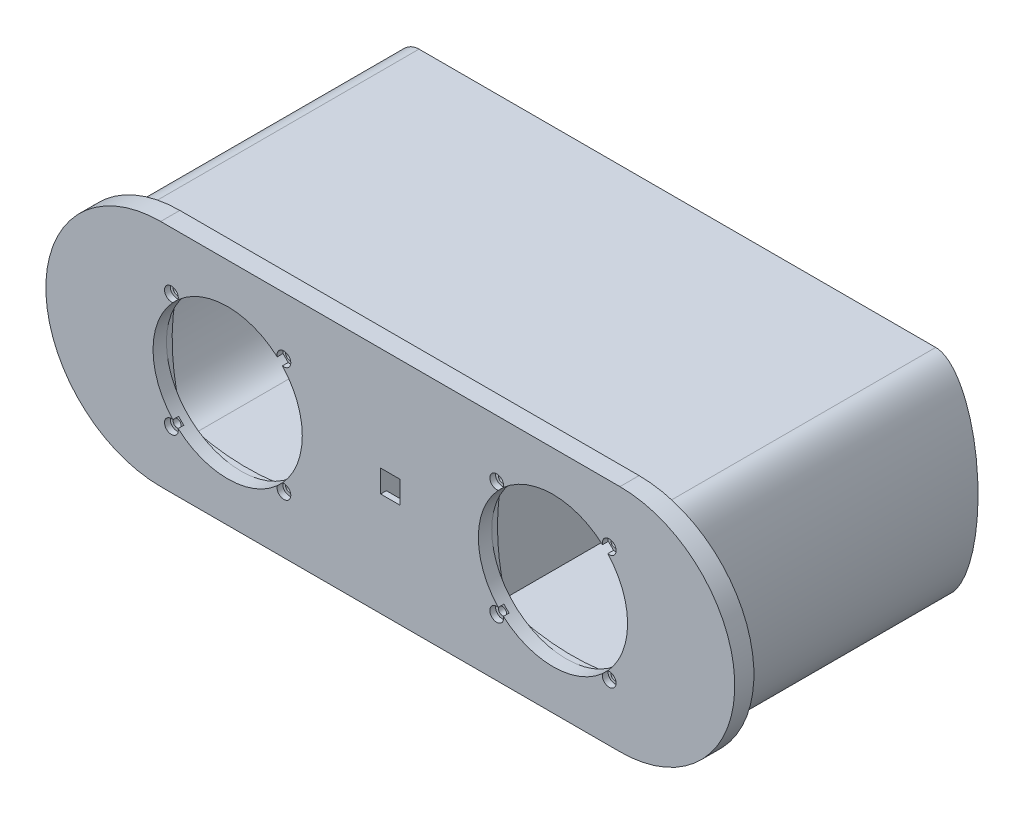
from build123d import *

# Parameters (mm, degrees)
BOSS_EXTRU_1_DEPTH                         = 7
BOSS_EXTRU_1_DEPTH_BACK                    = 3
ESQUISSE2_R                                = 39
ESQUISSE2_R_2                              = 2.1
ENL_V_START                                = -3
ESQUISSE2_5_R                              = 2.1
ENL_V_MAT_EXTRU_1_DEPTH                    = 3
ESQUISSE5_R                                = 3.6
ENL_V_MAT_EXTRU_2_DEPTH                    = 3
ESQUISSE6_W                                = 50
ESQUISSE6_H                                = 105
BOSS_EXTRU_2_DEPTH                         = 140
BOSS_EXTRU_3_DEPTH                         = 14
ESQUISSE8_R                                = 4.05
ENL_V_MAT_EXTRU_3_DEPTH                    = 1.22
SYM_TRIE1_AT_THE_SECOND_PLANE_COPY_1_DEPTH = 14
SYM_TRIE1_AT_THE_SECOND_PLANE_COPY_2_SKE_R = 4.05
SYM_TRIE1_AT_THE_SECOND_PLANE_COPY_2_DEPTH = 1.22
CONG_1_R                                   = 10
ESQUISSE9_R                                = 4.05
ENL_V_MAT_EXTRU_4_DEPTH                    = 1.22
ENL_V_MAT_EXTRU_5_REACH                    = 261.447
ESQUISSE10_R                               = 10
ENL_V_MAT_EXTRU_6_REACH                    = 312.363
ESQUISSE11_W                               = 9.7
ESQUISSE11_H                               = 11.35
D_PLACER_START                             = -90.05
D_PLACER_LA_FACE1_OUTLINE_W                = 11.75
D_PLACER_LA_FACE1_OUTLINE_H                = 10
D_PLACER_LA_FACE1_DEPTH                    = 10.1
ESQUISSE12_W                               = 10.1
ESQUISSE12_H                               = 20
ENL_V_MAT_EXTRU_7_DEPTH                    = 7


# Read off the part's stored shape, not the designer's step: Déplacer la face1
with BuildPart() as part:
    # Esquisse2 → Boss.-Extru.1 (new, two sides: drawn at the far end of the back side and taken through both)
    with BuildSketch(Plane.XY.offset(-BOSS_EXTRU_1_DEPTH_BACK)):
        with BuildLine():
            Line((-205, 60), (35, 60))
            ThreePointArc((35, 60), (95, 0), (35, -60))
            Line((35, -60), (-205, -60))
            ThreePointArc((-205, -60), (-265, 0), (-205, 60))
        make_face()
        Circle(ESQUISSE2_R, mode=Mode.SUBTRACT)
        with Locations((-170, 0)):
            Circle(ESQUISSE2_R, mode=Mode.SUBTRACT)
        with Locations((-140.606123087, 30)):
            Circle(ESQUISSE2_R_2, mode=Mode.SUBTRACT)
        with Locations((-199.393876913, 30)):
            Circle(ESQUISSE2_R_2, mode=Mode.SUBTRACT)
        with Locations((-199.393876913, -30)):
            Circle(ESQUISSE2_R_2, mode=Mode.SUBTRACT)
        with Locations((-140.606123087, -30)):
            Circle(ESQUISSE2_R_2, mode=Mode.SUBTRACT)
        with Locations((29.393876913, -30)):
            Circle(ESQUISSE2_R_2, mode=Mode.SUBTRACT)
        with Locations((-29.393876913, -30)):
            Circle(ESQUISSE2_R_2, mode=Mode.SUBTRACT)
        with Locations((-29.393876913, 30)):
            Circle(ESQUISSE2_R_2, mode=Mode.SUBTRACT)
        with Locations((29.393876913, 30)):
            Circle(ESQUISSE2_R_2, mode=Mode.SUBTRACT)
    extrude(amount=BOSS_EXTRU_1_DEPTH + BOSS_EXTRU_1_DEPTH_BACK)

    # Esquisse2<5> → Enlèv. mat.-Extru.1 (cut)
    # profile 1 of 10: a face of its own
    with BuildSketch(Plane.XY.offset(ENL_V_START)):
        with BuildLine():
            ThreePointArc((-170.000000312, -39), (-142.422835644, -27.577164577), (-131, 0))
            ThreePointArc((-131, 0), (-142.422835466, 27.577164398), (-169.999999807, 39))
            ThreePointArc((-169.999999807, 39), (-197.577164398, 27.577164534), (-209, 0))
            ThreePointArc((-209, 0), (-197.577164577, -27.577164356), (-170.000000312, -39))
        make_face()
    # profile 2 of 10: a face of its own
    with BuildSketch(Plane.XY.offset(ENL_V_START)):
        with BuildLine():
            ThreePointArc((-169.999999807, 39), (-142.422835466, 27.577164398), (-131, 0))
            add(Edge.make_bspline(
                [(-131, 0), (-131, 18.042697598), (-136.4238654, 33.5761346)],
                knots=[4.71238898, 4.71238898, 4.71238898, 5.246097172, 5.246097172, 5.246097172], degree=2, weights=[0.930463264, 0.930463264, 1]))
            add(Edge.make_bspline(
                [(-136.4238654, 33.5761346), (-151.957302313, 38.999999969), (-169.999999807, 39)],
                knots=[1.037088135, 1.037088135, 1.037088135, 1.570796324, 1.570796324, 1.570796324], degree=2, weights=[1, 0.930463264, 0.930463264]))
        make_face()
        with Locations((-140.606123087, 30)):
            Circle(ESQUISSE2_5_R, mode=Mode.SUBTRACT)
    # profile 3 of 10: a face of its own
    with BuildSketch(Plane.XY.offset(ENL_V_START)):
        with BuildLine():
            ThreePointArc((-209, 0), (-197.577164398, 27.577164534), (-169.999999807, 39))
            add(Edge.make_bspline(
                [(-169.999999807, 39), (-188.042697509, 39.000000031), (-203.5761346, 33.5761346)],
                knots=[1.570796324, 1.570796324, 1.570796324, 2.104504518, 2.104504518, 2.104504518], degree=2, weights=[0.930463264, 0.930463264, 1]))
            add(Edge.make_bspline(
                [(-203.5761346, 33.5761346), (-209, 18.042697598), (-209, 0)],
                knots=[4.178680789, 4.178680789, 4.178680789, 4.71238898, 4.71238898, 4.71238898], degree=2, weights=[1, 0.930463264, 0.930463264]))
        make_face()
        with Locations((-199.393876913, 30)):
            Circle(ESQUISSE2_5_R, mode=Mode.SUBTRACT)
    # profile 4 of 10: a face of its own
    with BuildSketch(Plane.XY.offset(ENL_V_START)):
        with BuildLine():
            add(Edge.make_bspline(
                [(-203.5761346, -33.5761346), (-188.042697742, -38.99999995), (-170.000000312, -39)],
                knots=[1.037088135, 1.037088135, 1.037088135, 1.570796322, 1.570796322, 1.570796322], degree=2, weights=[1, 0.930463265, 0.930463264]))
            ThreePointArc((-170.000000312, -39), (-197.577164577, -27.577164356), (-209, 0))
            add(Edge.make_bspline(
                [(-209, 0), (-209, -18.042697598), (-203.5761346, -33.5761346)],
                knots=[4.71238898, 4.71238898, 4.71238898, 5.246097172, 5.246097172, 5.246097172], degree=2, weights=[0.930463264, 0.930463264, 1]))
        make_face()
        with Locations((-199.393876913, -30)):
            Circle(ESQUISSE2_5_R, mode=Mode.SUBTRACT)
    # profile 5 of 10: a face of its own
    with BuildSketch(Plane.XY.offset(ENL_V_START)):
        with BuildLine():
            add(Edge.make_bspline(
                [(-136.4238654, -33.5761346), (-131, -18.042697598), (-131, 0)],
                knots=[4.178680789, 4.178680789, 4.178680789, 4.71238898, 4.71238898, 4.71238898], degree=2, weights=[1, 0.930463264, 0.930463264]))
            ThreePointArc((-131, 0), (-142.422835644, -27.577164577), (-170.000000312, -39))
            add(Edge.make_bspline(
                [(-170.000000312, -39), (-151.957302546, -39.00000005), (-136.4238654, -33.5761346)],
                knots=[1.570796322, 1.570796322, 1.570796322, 2.104504518, 2.104504518, 2.104504518], degree=2, weights=[0.930463264, 0.930463264, 1]))
        make_face()
        with Locations((-140.606123087, -30)):
            Circle(ESQUISSE2_5_R, mode=Mode.SUBTRACT)
    # profile 6 of 10: a face of its own
    with BuildSketch(Plane.XY.offset(ENL_V_START)):
        with BuildLine():
            ThreePointArc((-1.99e-07, -39), (27.577164396, -27.577164537), (39, 0))
            ThreePointArc((39, 0), (27.577164371, 27.577164562), (-2.7e-07, 39))
            ThreePointArc((-2.7e-07, 39), (-27.577164634, 27.577164299), (-39, -2.03e-07))
            ThreePointArc((-39, -2.03e-07), (-27.577164465, -27.577164468), (-1.99e-07, -39))
        make_face()
    # profile 7 of 10: a face of its own
    with BuildSketch(Plane.XY.offset(ENL_V_START)):
        with BuildLine():
            ThreePointArc((-39, -2.03e-07), (-27.577164634, 27.577164299), (-2.7e-07, 39))
            add(Edge.make_bspline(
                [(-2.7e-07, 39), (-18.042697723, 38.999999956), (-33.5761346, 33.5761346)],
                knots=[4.712388984, 4.712388984, 4.712388984, 5.246097172, 5.246097172, 5.246097172], degree=2, weights=[0.930463264, 0.930463265, 1]))
            add(Edge.make_bspline(
                [(-33.5761346, 33.5761346), (-39.000000033, 18.042697504), (-39, -2.03e-07)],
                knots=[1.037088135, 1.037088135, 1.037088135, 1.57079633, 1.57079633, 1.57079633], degree=2, weights=[1, 0.930463264, 0.930463264]))
        make_face()
        with Locations((-29.393876913, 30)):
            Circle(ESQUISSE2_5_R, mode=Mode.SUBTRACT)
    # profile 8 of 10: a face of its own
    with BuildSketch(Plane.XY.offset(ENL_V_START)):
        with BuildLine():
            ThreePointArc((-2.7e-07, 39), (27.577164371, 27.577164562), (39, 0))
            add(Edge.make_bspline(
                [(39, 0), (39, 18.042697598), (33.5761346, 33.5761346)],
                knots=[4.71238898, 4.71238898, 4.71238898, 5.246097172, 5.246097172, 5.246097172], degree=2, weights=[0.930463264, 0.930463264, 1]))
            add(Edge.make_bspline(
                [(33.5761346, 33.5761346), (18.042697473, 39.000000044), (-2.7e-07, 39)],
                knots=[4.178680789, 4.178680789, 4.178680789, 4.712388984, 4.712388984, 4.712388984], degree=2, weights=[1, 0.930463264, 0.930463264]))
        make_face()
        with Locations((29.393876913, 30)):
            Circle(ESQUISSE2_5_R, mode=Mode.SUBTRACT)
    # profile 9 of 10: a face of its own
    with BuildSketch(Plane.XY.offset(ENL_V_START)):
        with BuildLine():
            add(Edge.make_bspline(
                [(33.5761346, -33.5761346), (39, -18.042697598), (39, 0)],
                knots=[4.178680789, 4.178680789, 4.178680789, 4.71238898, 4.71238898, 4.71238898], degree=2, weights=[1, 0.930463264, 0.930463264]))
            ThreePointArc((39, 0), (27.577164396, -27.577164537), (-1.99e-07, -39))
            add(Edge.make_bspline(
                [(-1.99e-07, -39), (18.042697506, -39.000000032), (33.5761346, -33.5761346)],
                knots=[1.570796324, 1.570796324, 1.570796324, 2.104504518, 2.104504518, 2.104504518], degree=2, weights=[0.930463264, 0.930463264, 1]))
        make_face()
        with Locations((29.393876913, -30)):
            Circle(ESQUISSE2_5_R, mode=Mode.SUBTRACT)
    # profile 10 of 10: a face of its own
    with BuildSketch(Plane.XY.offset(ENL_V_START)):
        with BuildLine():
            add(Edge.make_bspline(
                [(-33.5761346, -33.5761346), (-18.04269769, -38.999999968), (-1.99e-07, -39)],
                knots=[1.037088135, 1.037088135, 1.037088135, 1.570796324, 1.570796324, 1.570796324], degree=2, weights=[1, 0.930463264, 0.930463264]))
            ThreePointArc((-1.99e-07, -39), (-27.577164465, -27.577164468), (-39, -2.03e-07))
            add(Edge.make_bspline(
                [(-39, -2.03e-07), (-38.999999967, -18.042697692), (-33.5761346, -33.5761346)],
                knots=[1.57079633, 1.57079633, 1.57079633, 2.104504518, 2.104504518, 2.104504518], degree=2, weights=[0.930463264, 0.930463264, 1]))
        make_face()
        with Locations((-29.393876913, -30)):
            Circle(ESQUISSE2_5_R, mode=Mode.SUBTRACT)
    extrude(amount=ENL_V_MAT_EXTRU_1_DEPTH, mode=Mode.SUBTRACT)

    # Esquisse5 → Enlèv. mat.-Extru.2 (cut)
    with BuildSketch(Plane.XY.offset(7)):
        with Locations((-199.393876913, 30)):
            Circle(ESQUISSE5_R)
        with Locations((-140.606123087, 30)):
            Circle(ESQUISSE5_R)
        with Locations((-140.606123087, -30)):
            Circle(ESQUISSE5_R)
        with Locations((-199.393876913, -30)):
            Circle(ESQUISSE5_R)
        with Locations((29.393876913, -30)):
            Circle(ESQUISSE5_R)
        with Locations((-29.393876913, -30)):
            Circle(ESQUISSE5_R)
        with Locations((-29.393876913, 30)):
            Circle(ESQUISSE5_R)
        with Locations((29.393876913, 30)):
            Circle(ESQUISSE5_R)
    extrude(amount=-ENL_V_MAT_EXTRU_2_DEPTH, mode=Mode.SUBTRACT)

    # Esquisse6 → Boss.-Extru.2 (add)
    with BuildSketch(Plane(origin=(0, 0, -3), x_dir=(-1, 0, 0), z_dir=(0, 0, -1))):
        with BuildLine():
            Line((-50, 55.5), (220, 55.5))
            add(Edge.make_bspline(
                [(220, -55.5), (242.127031703, -55.5), (242.127031703, 0), (242.127031703, 55.5), (220, 55.5)],
                knots=[3.141592654, 3.141592654, 3.141592654, 4.71238898, 4.71238898, 6.283185307, 6.283185307, 6.283185307], degree=2, weights=[1, 0.707106781, 1, 0.707106781, 1]))
            Line((220, -55.5), (-50, -55.5))
            add(Edge.make_bspline(
                [(-50, 55.5), (-72.127031703, 55.5), (-72.127031703, 0), (-72.127031703, -55.5), (-50, -55.5)],
                knots=[0, 0, 0, 1.570796327, 1.570796327, 3.141592654, 3.141592654, 3.141592654], degree=2, weights=[1, 0.707106781, 1, 0.707106781, 1]))
        make_face()
        with BuildLine():
            Line((-42.740206083, 52.5), (57, 52.5))
            Line((57, 52.5), (57, -52.5))
            Line((57, -52.5), (-42.740206083, -52.5))
            add(Edge.make_bspline(
                [(-42.740206083, 52.5), (-67.250334131, 52.5), (-67.250334131, 0), (-67.250334131, -52.5), (-42.740206083, -52.5)],
                knots=[0, 0, 0, 1.570796327, 1.570796327, 3.141592654, 3.141592654, 3.141592654], degree=2, weights=[1, 0.707106781, 1, 0.707106781, 1]))
        make_face(mode=Mode.SUBTRACT)
        with BuildLine():
            Line((212.740206083, -52.5), (113, -52.5))
            Line((113, -52.5), (113, 52.5))
            Line((113, 52.5), (212.740206083, 52.5))
            add(Edge.make_bspline(
                [(212.740206083, -52.5), (237.250334131, -52.5), (237.250334131, 0), (237.250334131, 52.5), (212.740206083, 52.5)],
                knots=[3.141592654, 3.141592654, 3.141592654, 4.71238898, 4.71238898, 6.283185307, 6.283185307, 6.283185307], degree=2, weights=[1, 0.707106781, 1, 0.707106781, 1]))
        make_face(mode=Mode.SUBTRACT)
        with Locations((85, 0)):
            Rectangle(ESQUISSE6_W, ESQUISSE6_H, mode=Mode.SUBTRACT)
    extrude(amount=BOSS_EXTRU_2_DEPTH)

    # Esquisse7 → Boss.-Extru.3 (add)
    with BuildSketch(Plane(origin=(0, 0, -143), x_dir=(-1, 0, 0), z_dir=(0, 0, -1))):
        with BuildLine():
            Line((37, 52.5), (57, 52.5))
            Line((57, 52.5), (57, 32.5))
            ThreePointArc((57, 32.5), (42.857864376, 38.357864376), (37, 52.5))
        make_face()
    boss_extru_3 = extrude(amount=-BOSS_EXTRU_3_DEPTH)

    # Esquisse8 → Enlèv. mat.-Extru.3 (cut)
    with BuildSketch(Plane(origin=(0, 0, -143), x_dir=(-1, 0, 0), z_dir=(0, 0, -1))):
        with Locations((49.106010524, 43.512538926)):
            Circle(ESQUISSE8_R)
    enl_v_mat_extru_3 = extrude(amount=-ENL_V_MAT_EXTRU_3_DEPTH, mode=Mode.SUBTRACT)

    # Symétrie1: Boss.-Extru.3, Enlèv. mat.-Extru.3 across plane
    add(boss_extru_3.mirror(Plane.ZY.offset(85)))
    add(enl_v_mat_extru_3.mirror(Plane.ZY.offset(85)), mode=Mode.SUBTRACT)

    # Symétrie1 at the second plane: Boss.-Extru.3, Enlèv. mat.-Extru.3 across plane
    add(boss_extru_3.mirror(Plane.ZX))
    add(enl_v_mat_extru_3.mirror(Plane.ZX), mode=Mode.SUBTRACT)

    # Symétrie1 at the second plane copy 1 ske → Symétrie1 at the second plane copy 1 (add)
    with BuildSketch(Plane(origin=(-170, 0, -143), x_dir=(1, 0, 0), z_dir=(0, 0, -1))):
        with BuildLine():
            Line((37, 52.5), (57, 52.5))
            Line((57, 52.5), (57, 32.5))
            ThreePointArc((57, 32.5), (42.857864376, 38.357864376), (37, 52.5))
        make_face()
    extrude(amount=-SYM_TRIE1_AT_THE_SECOND_PLANE_COPY_1_DEPTH)

    # Symétrie1 at the second plane copy 2 ske → Symétrie1 at the second plane copy 2 (cut)
    with BuildSketch(Plane(origin=(-170, 0, -143), x_dir=(1, 0, 0), z_dir=(0, 0, -1))):
        with Locations((49.106010524, 43.512538926)):
            Circle(SYM_TRIE1_AT_THE_SECOND_PLANE_COPY_2_SKE_R)
    extrude(amount=-SYM_TRIE1_AT_THE_SECOND_PLANE_COPY_2_DEPTH, mode=Mode.SUBTRACT)

    # Congé1
    cong_1_edges = [part.edges().sort_by_distance(p)[0] for p in [
        (-57, 32.5, -136),
        (-37, 52.5, -136),
        (-57, -32.5, -136),
        (-37, -52.5, -136),
        (-113, 32.5, -136),
        (-133, 52.5, -136),
        (-113, -32.5, -136),
        (-133, -52.5, -136),
    ]]
    fillet(cong_1_edges, radius=CONG_1_R)

    # Esquisse9 → Enlèv. mat.-Extru.4 (cut)
    with BuildSketch(Plane(origin=(0, 0, -3), x_dir=(-1, 0, 0), z_dir=(0, 0, -1))):
        with Locations((85, -27.5)):
            Circle(ESQUISSE9_R)
    extrude(amount=-ENL_V_MAT_EXTRU_4_DEPTH, mode=Mode.SUBTRACT)

    # Esquisse10 → Enlèv. mat.-Extru.5 (cut, up to next)
    with BuildSketch(Plane.ZY.offset(113), mode=Mode.PRIVATE) as enl_v_mat_extru_5_sk1:
        with Locations((-33, 35.5)):
            Circle(ESQUISSE10_R)
    enl_v_mat_extru_5_tool1 = extrude(enl_v_mat_extru_5_sk1.sketch, amount=-ENL_V_MAT_EXTRU_5_REACH, mode=Mode.PRIVATE) & part.part
    enl_v_mat_extru_5 = enl_v_mat_extru_5_tool1.solids().sort_by_distance((-113, 35.5, -33))[0]
    add(enl_v_mat_extru_5, mode=Mode.SUBTRACT)

    # Symétrie2: Enlèv. mat.-Extru.5 across plane
    add(enl_v_mat_extru_5.mirror(Plane.ZY.offset(85)), mode=Mode.SUBTRACT)

    # Esquisse11 → Enlèv. mat.-Extru.6 (cut, up to next)
    with BuildSketch(Plane.XY.offset(7), mode=Mode.PRIVATE) as enl_v_mat_extru_6_sk1:
        with Locations((-85, 0)):
            Rectangle(ESQUISSE11_W, ESQUISSE11_H)
    enl_v_mat_extru_6_tool1 = extrude(enl_v_mat_extru_6_sk1.sketch, amount=-ENL_V_MAT_EXTRU_6_REACH, mode=Mode.PRIVATE) & part.part
    add(enl_v_mat_extru_6_tool1.solids().sort_by_distance((-85, 0, 7))[0], mode=Mode.SUBTRACT)

    # Déplacer la face1 outline → Déplacer la face1 (cut)
    with BuildSketch(Plane.YZ.offset(D_PLACER_START)):
        with Locations((0, 2)):
            Rectangle(D_PLACER_LA_FACE1_OUTLINE_W, D_PLACER_LA_FACE1_OUTLINE_H)
    extrude(amount=D_PLACER_LA_FACE1_DEPTH, mode=Mode.SUBTRACT)

    # Esquisse12 → Enlèv. mat.-Extru.7 (cut)
    with BuildSketch(Plane(origin=(0, 0, -3), x_dir=(-1, 0, 0), z_dir=(0, 0, -1))):
        with Locations((85, -4.125)):
            Rectangle(ESQUISSE12_W, ESQUISSE12_H)
    extrude(amount=-ENL_V_MAT_EXTRU_7_DEPTH, mode=Mode.SUBTRACT)


solid = part.part
